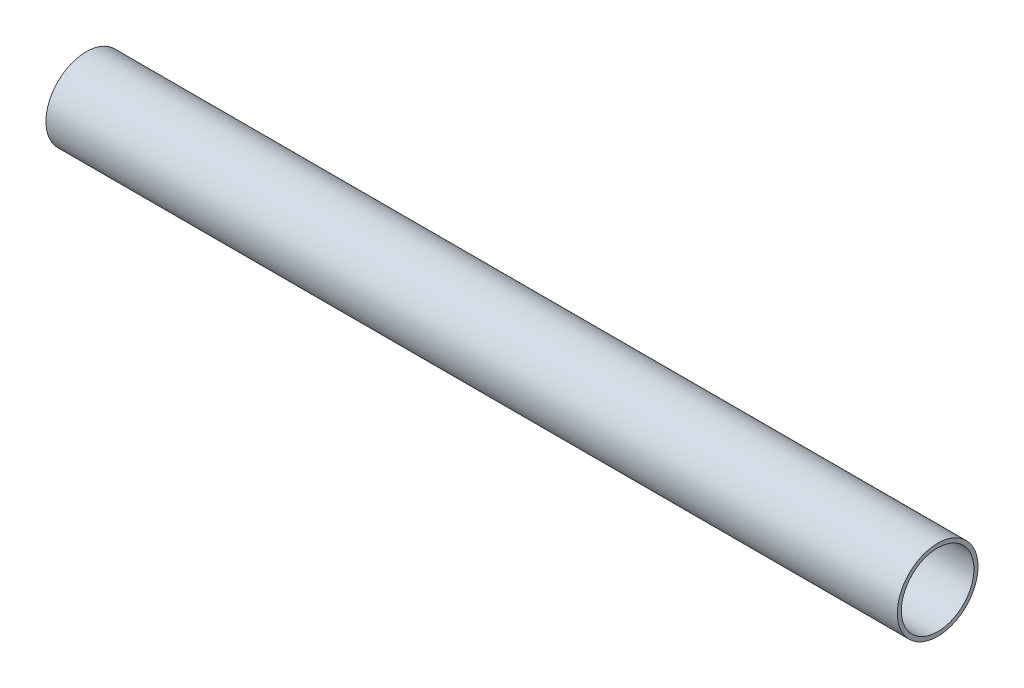
from build123d import *

# Parameters (mm, degrees)
SKETCH1_R           = 15.875
SKETCH1_R_2         = 14.2875
EXTRUDE_THIN1_DEPTH = 167.48125


with BuildPart() as part:
    # Sketch1 → Extrude-Thin1 (new, symmetric)
    with BuildSketch(Plane(origin=(0, 0, 0), x_dir=(0, 0, -1), z_dir=(1, 0, 0))):
        Circle(SKETCH1_R)
        Circle(SKETCH1_R_2, mode=Mode.SUBTRACT)
    extrude(amount=EXTRUDE_THIN1_DEPTH, both=True)


solid = part.part
